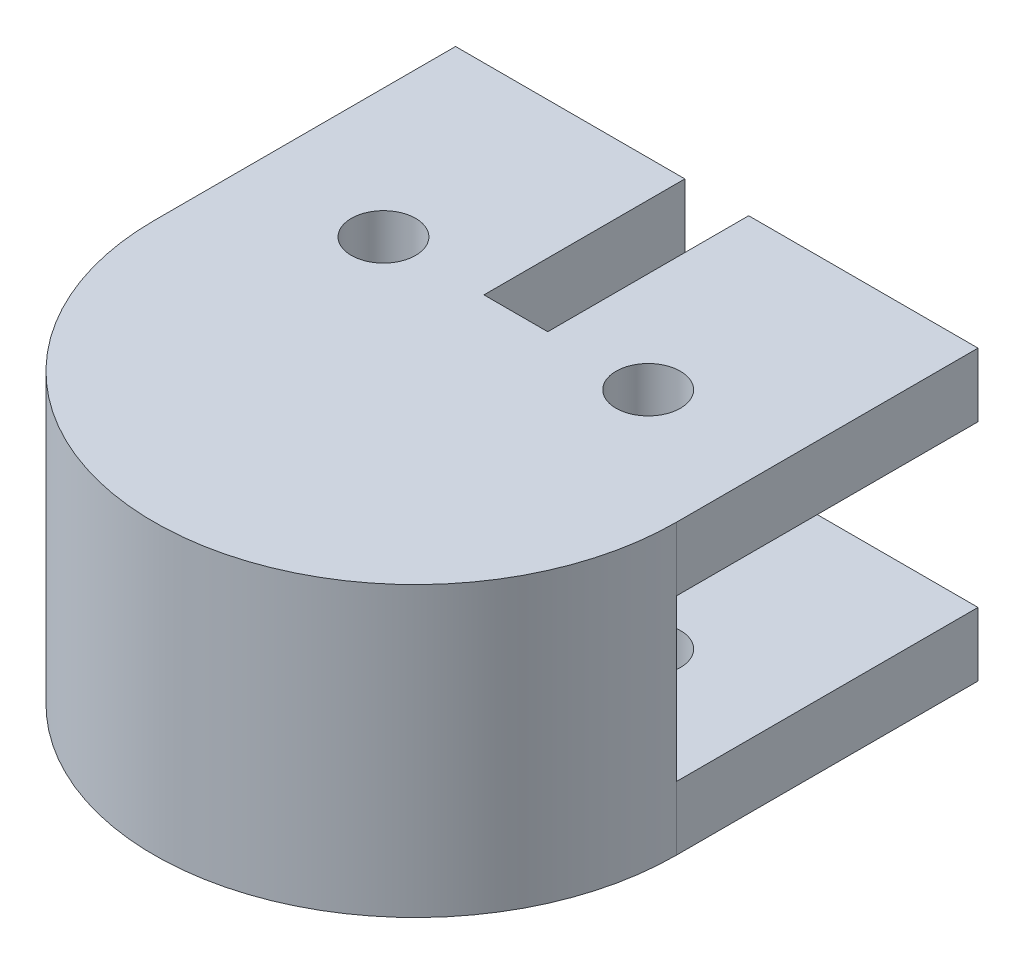
from build123d import *

# Parameters (mm, degrees)
SKETCH1_R           = 1.6
BOSS_EXTRUDE1_DEPTH = 3.175
BOSS_EXTRUDE3_START = 4
BOSS_EXTRUDE3_DEPTH = 4


with BuildPart() as part:
    # Sketch1 → Boss-Extrude1 (new body)
    with BuildSketch(Plane(origin=(0, 0, 0), x_dir=(1, 0, 0), z_dir=(0, 1, 0))):
        with BuildLine():
            Line((-1.5875, 0), (1.5875, 0))
            Line((1.5875, 0), (1.5875, 10))
            Line((1.5875, 10), (13, 10))
            Line((13, 10), (13, -5))
            ThreePointArc((13, -5), (0, -18), (-13, -5))
            Line((-13, -5), (-13, 10))
            Line((-13, 10), (-1.5875, 10))
            Line((-1.5875, 10), (-1.5875, 0))
        make_face()
        with Locations((6.5875, 0)):
            Circle(SKETCH1_R, mode=Mode.SUBTRACT)
        with Locations((-6.5875, 0)):
            Circle(SKETCH1_R, mode=Mode.SUBTRACT)
    boss_extrude1 = extrude(amount=BOSS_EXTRUDE1_DEPTH)

    # Sketch3 → Boss-Extrude3 (add)
    with BuildSketch(Plane.XZ.offset(BOSS_EXTRUDE3_START)):
        with BuildLine():
            Line((4.0875, -10), (1.5875, -10))
            Line((1.5875, -10), (1.5875, 0))
            Line((1.5875, 0), (-1.5875, 0))
            Line((-1.5875, 0), (-1.5875, -10))
            Line((-1.5875, -10), (-4.0875, -10))
            Line((-4.0875, -10), (-4.0875, 5))
            Line((-4.0875, 5), (-13, 5))
            ThreePointArc((-13, 5), (0, 18), (13, 5))
            Line((13, 5), (4.0875, 5))
            Line((4.0875, 5), (4.0875, -10))
        make_face()
    boss_extrude3 = extrude(amount=-BOSS_EXTRUDE3_DEPTH)

    # Mirror11: Boss-Extrude3 across plane
    add(boss_extrude3.mirror(Plane(origin=(0, -4, 0), x_dir=(0, 0, 1), z_dir=(0, -1, 0))))

    # Mirror12: Boss-Extrude1 across plane
    add(boss_extrude1.mirror(Plane(origin=(0, -4, 0), x_dir=(0, 0, 1), z_dir=(0, -1, 0))))


solid = part.part
